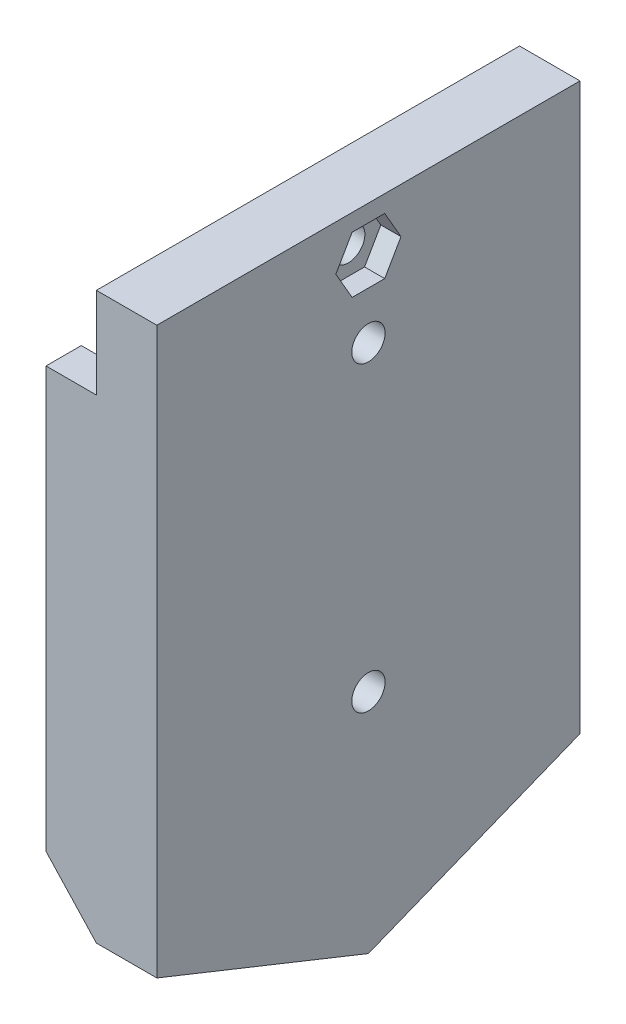
from build123d import *

# Parameters (mm, degrees)
ESBO_O1_W                = 6
ESBO_O1_H                = 65
RESSALTO_EXTRUS_O1_DEPTH = 21
RESSALTO_EXTRUS_O4_DEPTH = 5
CORTE_EXTRUS_O6_START    = -1
CORTE_EXTRUS_O6_DEPTH    = 4
CHANFRO1_SIZE            = 6.4
CHANFRO2_SIZE            = 6.4
ESBO_O15_R               = 1.65
CORTE_EXTRUS_O7_DEPTH    = 41.227478171
CORTE_EXTRUS_O8_DEPTH    = 2
ESBO_O17_R               = 3.5
CORTE_EXTRUS_O9_DEPTH    = 2.5
CORTE_EXTRUS_O10_DEPTH   = 40.15673633


with BuildPart() as part:
    # Esboço1 → Ressalto-extrusão1 (new, symmetric)
    with BuildSketch(Plane.XY):
        with Locations((3, 0)):
            Rectangle(ESBO_O1_W, ESBO_O1_H)
    extrude(amount=RESSALTO_EXTRUS_O1_DEPTH, both=True)

    # Esboço11 → Ressalto-extrusão4 (add)
    with BuildSketch(Plane.ZY):
        Polygon((-17.5, -9.5), (0, -16.5), (17.5, -9.5), (17.5, 23.5), (21, 23.5), (21, -16.716263691), (0, -25.116263691), (-21, -16.716263691), (-21, 23.5), (-17.5, 23.5), align=None)
    extrude(amount=RESSALTO_EXTRUS_O4_DEPTH)

    # Esboço12 → Corte-extrusão6 (cut)
    with BuildSketch(Plane.ZY.offset(5).offset(CORTE_EXTRUS_O6_START)):
        Polygon((-17.5, -9.5), (17.5, -9.5), (17.5, -16.5), (0, -23.5), (-17.5, -16.5), align=None)
    extrude(amount=-CORTE_EXTRUS_O6_DEPTH, mode=Mode.SUBTRACT)

    # Chanfro1
    # the kernel refuses this chamfer: 6.4 mm, written as the material it adds along each edge
    with BuildSketch(Plane(origin=(-4, -29.612634139, 15.281585348), x_dir=(-0.0274958766105864, 0.9281256495501803, 0.3712502598200724), z_dir=(0, 0.371390676354104, -0.9284766908852593))) as chanfro1_piece_1_section:
        Polygon((CHANFRO1_SIZE * 0.999621916911, CHANFRO1_SIZE * 0.0274958766106), (-CHANFRO1_SIZE * 0.0274958766106, CHANFRO1_SIZE * 0.999621916911), (0, 0), align=None)
    chanfro1_piece_1 = extrude(amount=51.765619071, mode=Mode.PRIVATE)
    chanfro1_piece_1 = split(chanfro1_piece_1, bisect_by=Plane(origin=(-1.981352532, -18.155988855, -17.5), z_dir=(0, 0, 1)), keep=Keep.TOP, mode=Mode.PRIVATE)
    chanfro1_piece_1 = split(chanfro1_piece_1, bisect_by=Plane(origin=(-1.981352532, -25.250248134, -4.375620334), z_dir=(0, 0.9284766908852594, -0.3713906763541037)), keep=Keep.TOP, mode=Mode.PRIVATE)
    add(chanfro1_piece_1)
    with BuildSketch(Plane(origin=(-4, -10.387365861, 32.781585348), x_dir=(-0.027495876610586396, 0.9281256495501804, -0.37125025982007215), z_dir=(0, -0.3713906763541037, -0.9284766908852594))) as chanfro1_piece_2_section:
        Polygon((CHANFRO1_SIZE * 0.999621916911, CHANFRO1_SIZE * 0.0274958766106), (-CHANFRO1_SIZE * 0.0274958766106, CHANFRO1_SIZE * 0.999621916911), (0, 0), align=None)
    chanfro1_piece_2 = extrude(amount=51.765619071, mode=Mode.PRIVATE)
    chanfro1_piece_2 = split(chanfro1_piece_2, bisect_by=Plane(origin=(-1.981352532, -18.155988855, 17.5), z_dir=(0, 0, -1)), keep=Keep.TOP, mode=Mode.PRIVATE)
    chanfro1_piece_2 = split(chanfro1_piece_2, bisect_by=Plane(origin=(-1.981352532, -25.250248134, 4.375620334), z_dir=(0, 0.9284766908852593, 0.371390676354104)), keep=Keep.TOP, mode=Mode.PRIVATE)
    add(chanfro1_piece_2)

    # Chanfro2
    # the kernel refuses this chamfer: 6.4 mm, written as the material it adds along each edge
    with BuildSketch(Plane(origin=(0, -31.228897831, 15.281585348), x_dir=(-0.9996219169112968, 0.025529280528386766, 0.010211712211354711), z_dir=(0, 0.37139067635410383, -0.9284766908852593))) as chanfro2_piece_1_section:
        Polygon((CHANFRO2_SIZE * 0.999621916911, -CHANFRO2_SIZE * 0.0274958766106), (-CHANFRO2_SIZE * 0.0274958766106, -CHANFRO2_SIZE * 0.999621916911), (0, 0), align=None)
    chanfro2_piece_1 = extrude(amount=55.535234436, mode=Mode.PRIVATE)
    chanfro2_piece_1 = split(chanfro2_piece_1, bisect_by=Plane(origin=(-5, -22.562055234, -11.871492952), z_dir=(1, 0, 0)), keep=Keep.TOP, mode=Mode.PRIVATE)
    chanfro2_piece_1 = split(chanfro2_piece_1, bisect_by=Plane(origin=(-1.967131821, -22.562055234, -21), z_dir=(0, 0, 1)), keep=Keep.TOP, mode=Mode.PRIVATE)
    chanfro2_piece_1 = split(chanfro2_piece_1, bisect_by=Plane(origin=(-1.967131821, -28.857577336, -9.353284111), z_dir=(0, 0.9284766908852593, -0.37139067635410383)), keep=Keep.TOP, mode=Mode.PRIVATE)
    add(chanfro2_piece_1)
    with BuildSketch(Plane(origin=(0, -10.603629552, 36.281585348), x_dir=(-0.9996219169112968, 0.02552928052838644, -0.010211712211354581), z_dir=(0, -0.37139067635410383, -0.9284766908852593))) as chanfro2_piece_2_section:
        Polygon((CHANFRO2_SIZE * 0.999621916911, -CHANFRO2_SIZE * 0.0274958766106), (-CHANFRO2_SIZE * 0.0274958766106, -CHANFRO2_SIZE * 0.999621916911), (0, 0), align=None)
    chanfro2_piece_2 = extrude(amount=55.535234436, mode=Mode.PRIVATE)
    chanfro2_piece_2 = split(chanfro2_piece_2, bisect_by=Plane(origin=(-5, -22.562055234, 11.871492952), z_dir=(1, 0, 0)), keep=Keep.TOP, mode=Mode.PRIVATE)
    chanfro2_piece_2 = split(chanfro2_piece_2, bisect_by=Plane(origin=(-1.967131821, -22.562055234, 21), z_dir=(0, 0, -1)), keep=Keep.TOP, mode=Mode.PRIVATE)
    chanfro2_piece_2 = split(chanfro2_piece_2, bisect_by=Plane(origin=(-1.967131821, -28.857577336, 9.353284111), z_dir=(0, 0.9284766908852593, 0.37139067635410383)), keep=Keep.TOP, mode=Mode.PRIVATE)
    add(chanfro2_piece_2)
    with BuildSketch(Plane(origin=(0, -10.603629552, 36.281585348), x_dir=(-0.9996219169112968, 0.02552928052838644, -0.010211712211354581), z_dir=(0, -0.37139067635410383, -0.9284766908852593))) as chanfro2_piece_3a_section:
        Polygon((CHANFRO2_SIZE * 0.999621916911, -CHANFRO2_SIZE * 0.0274958766106), (-CHANFRO2_SIZE * 0.0274958766106, -CHANFRO2_SIZE * 0.999621916911), (0, 0), align=None)
    chanfro2_piece_3a = extrude(amount=55.535234436, mode=Mode.PRIVATE)
    chanfro2_piece_3a = split(chanfro2_piece_3a, bisect_by=Plane(origin=(-5, -29.234460618, -4.706755421), z_dir=(1, 0, 0)), keep=Keep.TOP, mode=Mode.PRIVATE)
    chanfro2_piece_3a = split(chanfro2_piece_3a, bisect_by=Plane(origin=(-1.958615866, -24.061271743, -2.637479871), z_dir=(0, -0.9284766908852593, -0.37139067635410383)), keep=Keep.TOP, mode=Mode.PRIVATE)
    chanfro2_piece_3a = split(chanfro2_piece_3a, bisect_by=Plane(origin=(-1.958615866, -32.5, -4.706755421), z_dir=(0, 1, 0)), keep=Keep.TOP, mode=Mode.PRIVATE)
    with BuildSketch(Plane(origin=(0, -31.228897831, 15.281585348), x_dir=(-0.9996219169112968, 0.025529280528386766, 0.010211712211354711), z_dir=(0, 0.37139067635410383, -0.9284766908852593))) as chanfro2_piece_3b_section:
        Polygon((CHANFRO2_SIZE * 0.999621916911, -CHANFRO2_SIZE * 0.0274958766106), (-CHANFRO2_SIZE * 0.0274958766106, -CHANFRO2_SIZE * 0.999621916911), (0, 0), align=None)
    chanfro2_piece_3b = extrude(amount=55.535234436, mode=Mode.PRIVATE)
    chanfro2_piece_3b = split(chanfro2_piece_3b, bisect_by=Plane(origin=(-5, -29.234460618, 4.706755421), z_dir=(1, 0, 0)), keep=Keep.TOP, mode=Mode.PRIVATE)
    chanfro2_piece_3b = split(chanfro2_piece_3b, bisect_by=Plane(origin=(-1.958615866, -24.061271743, 2.637479871), z_dir=(0, -0.9284766908852593, 0.37139067635410383)), keep=Keep.TOP, mode=Mode.PRIVATE)
    chanfro2_piece_3b = split(chanfro2_piece_3b, bisect_by=Plane(origin=(-1.958615866, -32.5, 4.706755421), z_dir=(0, 1, 0)), keep=Keep.TOP, mode=Mode.PRIVATE)
    chanfro2_piece_3 = chanfro2_piece_3a & chanfro2_piece_3b
    add(chanfro2_piece_3)

    # Esboço15 → Corte-extrusão7 (cut, through all)
    with BuildSketch(Plane.ZY.offset(5)):
        with Locations((0, 28)):
            Circle(ESBO_O15_R)
        with Locations((0, 20.5)):
            Circle(ESBO_O15_R)
        with Locations((0, -9.5)):
            Circle(ESBO_O15_R)
    extrude(amount=-CORTE_EXTRUS_O7_DEPTH, mode=Mode.SUBTRACT)

    # Esboço16 → Corte-extrusão8 (cut)
    with BuildSketch(Plane(origin=(6, 0, 0), x_dir=(0, 0, -1), z_dir=(1, 0, 0))):
        Polygon((3.233161507, 28), (1.616580754, 30.8), (-1.616580754, 30.8), (-3.233161507, 28), (-1.616580754, 25.2), (1.616580754, 25.2), align=None)
    extrude(amount=-CORTE_EXTRUS_O8_DEPTH, mode=Mode.SUBTRACT)

    # Esboço17 → Corte-extrusão9 (cut)
    with BuildSketch(Plane.ZY):
        with Locations((0, 20.5)):
            Circle(ESBO_O17_R)
        with Locations((0, -9.5)):
            Circle(ESBO_O17_R)
    extrude(amount=-CORTE_EXTRUS_O9_DEPTH, mode=Mode.SUBTRACT)

    # Esboço18 → Corte-extrusão10 (cut, through all)
    with BuildSketch(Plane.ZY):
        Polygon((21, -23.609274645), (0, -32.009274645), (-21, -23.609274645), (-21, -32.5), (21, -32.5), align=None)
    extrude(amount=-CORTE_EXTRUS_O10_DEPTH, mode=Mode.SUBTRACT)


solid = part.part
